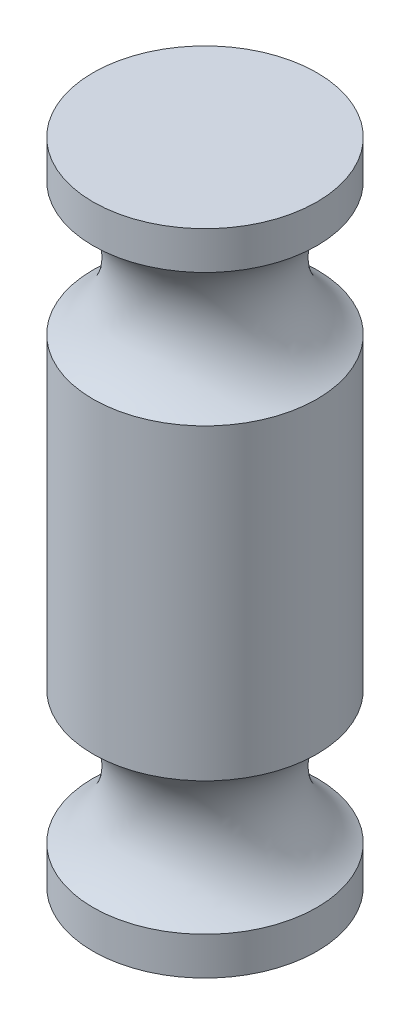
from build123d import *


with BuildPart() as part:
    # 草图1 → 旋转1 (revolve)
    with BuildSketch(Plane.XY):
        with BuildLine():
            Line((0, 0), (0, 8.56))
            Line((0, 8.56), (2.95, 8.56))
            Line((2.95, 8.56), (2.95, 7.56))
            ThreePointArc((2.95, 7.56), (1.918245837, 5.81), (2.95, 4.06))
            Line((2.95, 4.06), (2.95, -4.04))
            ThreePointArc((2.95, -4.04), (1.918245837, -5.79), (2.95, -7.54))
            Line((2.95, -7.54), (2.95, -8.54))
            Line((2.95, -8.54), (0, -8.54))
            Line((0, -8.54), (0, 0))
        make_face()
    revolve(axis=Axis((0, -8.54, 0), (0, 1, 0)))


solid = part.part
